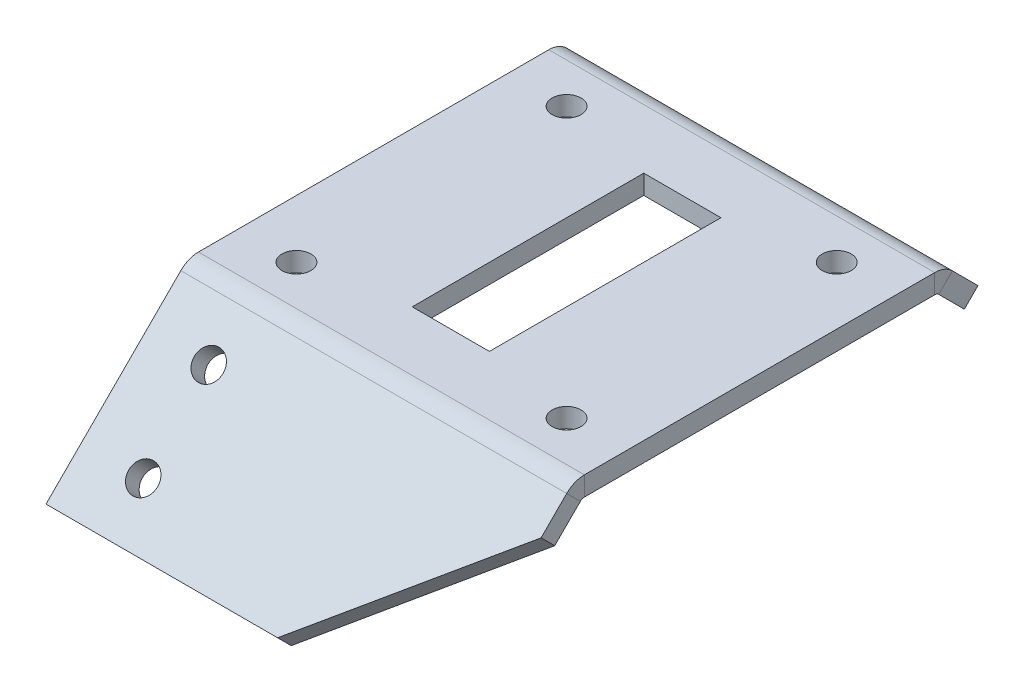
from build123d import *

# Parameters (mm, degrees)
SKETCH1_W                      = 50
SKETCH1_H                      = 46
BASE_FLANGE1_DEPTH             = 2.5
EDGE_FLANGE1_STRIP_CUT_DEPTH   = 50
EDGE_FLANGE1_STRIP_CUT_2_DEPTH = 50
EDGE_FLANGE1_DEPTH             = 50
EDGE_FLANGE1_BEND_DEPTH        = 50
CUT_EXTRUDE1_REACH             = 83.004
SKETCH13_R                     = 1.875
CUT_EXTRUDE2_REACH             = 70.62
SKETCH14_R                     = 1.875
CHAMFER1_SIZE                  = 20
CUT_EXTRUDE3_REACH             = 70.62
SKETCH15_W                     = 10
SKETCH15_H                     = 30


# Sheet-metal steps are written as plain solids
with BuildPart() as part:
    # Sketch1 → Base-Flange1 (new body)
    with BuildSketch(Plane(origin=(0, 0, 0), x_dir=(1, 0, 0), z_dir=(0, 1, 0))):
        with Locations((25, 0)):
            Rectangle(SKETCH1_W, SKETCH1_H)
    extrude(amount=BASE_FLANGE1_DEPTH)

    # Edge-Flange1 strip (across the edge) → Edge-Flange1 strip cut (cut)
    with BuildSketch(Plane(origin=(0, 0, -23), x_dir=(0, -0.7071067811865512, 0.7071067811865438), z_dir=(1, 0, 0))):
        Polygon((-9.66479933, 6.129265424), (-1.552021808, -1.983512098), (0.215745145, -0.215745145), (-7.897032377, 7.897032377), align=None)
    extrude(amount=EDGE_FLANGE1_STRIP_CUT_DEPTH, mode=Mode.SUBTRACT)

    # Edge-Flange1 strip 2 (across the edge) → Edge-Flange1 strip cut 2 (cut)
    with BuildSketch(Plane(origin=(50, 0, 23), x_dir=(0, -0.7071067811865512, -0.7071067811865438), z_dir=(-1, 0, 0))):
        Polygon((-9.66479933, 6.129265424), (-1.552021808, -1.983512098), (0.215745145, -0.215745145), (-7.897032377, 7.897032377), align=None)
    extrude(amount=EDGE_FLANGE1_STRIP_CUT_2_DEPTH, mode=Mode.SUBTRACT)

    # Edge-Flange1 section (across the edge) → Edge-Flange1 (add)
    with BuildSketch(Plane(origin=(0, 0, -23), x_dir=(0, -0.7071067811865512, 0.7071067811865438), z_dir=(1, 0, 0))):
        with BuildLine():
            Line((-2.5, 0.30510971), (-2.5, 25))
            Line((-2.5, 25), (0, 25))
            Line((0, 25), (0, 0.30510971))
            ThreePointArc((0, 0.30510971), (0.056070336, 0.023225094), (0.215745145, -0.215745145))
            Line((0.215745145, -0.215745145), (-1.552021808, -1.983512098))
            ThreePointArc((-1.552021808, -1.983512098), (-2.253628495, -0.933483487), (-2.5, 0.30510971))
        make_face()
    extrude(amount=EDGE_FLANGE1_DEPTH)

    # Edge-Flange1 section 2 (across the edge) → Edge-Flange1 bend (add)
    with BuildSketch(Plane(origin=(50, 0, 23), x_dir=(0, -0.7071067811865512, -0.7071067811865438), z_dir=(-1, 0, 0))):
        with BuildLine():
            Line((-2.5, 0.30510971), (-2.5, 25))
            Line((-2.5, 25), (0, 25))
            Line((0, 25), (0, 0.30510971))
            ThreePointArc((0, 0.30510971), (0.056070336, 0.023225094), (0.215745145, -0.215745145))
            Line((0.215745145, -0.215745145), (-1.552021808, -1.983512098))
            ThreePointArc((-1.552021808, -1.983512098), (-2.253628495, -0.933483487), (-2.5, 0.30510971))
        make_face()
    extrude(amount=EDGE_FLANGE1_BEND_DEPTH)

    # Sketch13 → Cut-Extrude1 (cut, up to next)
    with BuildSketch(Plane(origin=(0, 13.267766953, 13.267766953), x_dir=(1, 0, 0), z_dir=(0, 0.7071067811865513, 0.7071067811865438)), mode=Mode.PRIVATE) as cut_extrude1_sk1:
        with Locations(Location((8, -22.763455967, 0), (0, 0, 270))):
            Circle(SKETCH13_R)
    cut_extrude1_tool1 = extrude(cut_extrude1_sk1.sketch, amount=-CUT_EXTRUDE1_REACH, mode=Mode.PRIVATE) & part.part
    # Sketch13 → Cut-Extrude1 (cut, up to next)
    with BuildSketch(Plane(origin=(0, 13.267766953, 13.267766953), x_dir=(1, 0, 0), z_dir=(0, 0.7071067811865513, 0.7071067811865438)), mode=Mode.PRIVATE) as cut_extrude1_sk2:
        with Locations(Location((8, -34.763455967, 0), (0, 0, 270))):
            Circle(SKETCH13_R)
    cut_extrude1_tool2 = extrude(cut_extrude1_sk2.sketch, amount=-CUT_EXTRUDE1_REACH, mode=Mode.PRIVATE) & part.part
    cut_extrude1_1 = cut_extrude1_tool1.solids().sort_by_distance((8, -2.828427, 29.363961))[0]
    add(cut_extrude1_1, mode=Mode.SUBTRACT)
    cut_extrude1_2 = cut_extrude1_tool2.solids().sort_by_distance((8, -11.313708, 37.849242))[0]
    add(cut_extrude1_2, mode=Mode.SUBTRACT)
    cut_extrude1 = cut_extrude1_1 + cut_extrude1_2  # Cut-Extrude1 as one shape, for the pattern or mirror that repeats it

    # Mirror1: Cut-Extrude1 across plane
    add(cut_extrude1.mirror(Plane.XY), mode=Mode.SUBTRACT)

    # Sketch14 → Cut-Extrude2 (cut, up to next)
    with BuildSketch(Plane(origin=(0, 2.5, 0), x_dir=(1, 0, 0), z_dir=(0, 1, 0)), mode=Mode.PRIVATE) as cut_extrude2_sk1:
        with Locations(Location((7.5, 17.5, 0), (0, 0, 270))):
            Circle(SKETCH14_R)
    cut_extrude2_tool1 = extrude(cut_extrude2_sk1.sketch, amount=-CUT_EXTRUDE2_REACH, mode=Mode.PRIVATE) & part.part
    # Sketch14 → Cut-Extrude2 (cut, up to next)
    with BuildSketch(Plane(origin=(0, 2.5, 0), x_dir=(1, 0, 0), z_dir=(0, 1, 0)), mode=Mode.PRIVATE) as cut_extrude2_sk2:
        with Locations(Location((42.5, 17.5, 0), (0, 0, 270))):
            Circle(SKETCH14_R)
    cut_extrude2_tool2 = extrude(cut_extrude2_sk2.sketch, amount=-CUT_EXTRUDE2_REACH, mode=Mode.PRIVATE) & part.part
    # Sketch14 → Cut-Extrude2 (cut, up to next)
    with BuildSketch(Plane(origin=(0, 2.5, 0), x_dir=(1, 0, 0), z_dir=(0, 1, 0)), mode=Mode.PRIVATE) as cut_extrude2_sk3:
        with Locations(Location((7.5, -17.5, 0), (0, 0, 270))):
            Circle(SKETCH14_R)
    cut_extrude2_tool3 = extrude(cut_extrude2_sk3.sketch, amount=-CUT_EXTRUDE2_REACH, mode=Mode.PRIVATE) & part.part
    # Sketch14 → Cut-Extrude2 (cut, up to next)
    with BuildSketch(Plane(origin=(0, 2.5, 0), x_dir=(1, 0, 0), z_dir=(0, 1, 0)), mode=Mode.PRIVATE) as cut_extrude2_sk4:
        with Locations(Location((42.5, -17.5, 0), (0, 0, 270))):
            Circle(SKETCH14_R)
    cut_extrude2_tool4 = extrude(cut_extrude2_sk4.sketch, amount=-CUT_EXTRUDE2_REACH, mode=Mode.PRIVATE) & part.part
    add(cut_extrude2_tool1.solids().sort_by_distance((7.5, 2.5, -17.5))[0], mode=Mode.SUBTRACT)
    add(cut_extrude2_tool2.solids().sort_by_distance((42.5, 2.5, -17.5))[0], mode=Mode.SUBTRACT)
    add(cut_extrude2_tool3.solids().sort_by_distance((7.5, 2.5, 17.5))[0], mode=Mode.SUBTRACT)
    add(cut_extrude2_tool4.solids().sort_by_distance((42.5, 2.5, 17.5))[0], mode=Mode.SUBTRACT)

    # Chamfer1
    chamfer1_edges = [part.edges().sort_by_distance(p)[0] for p in [
        (50, -16.793786053, -41.561553006),
        (50, -16.793786053, 41.561553006),
    ]]
    chamfer(chamfer1_edges, length=CHAMFER1_SIZE)

    # Sketch15 → Cut-Extrude3 (cut, up to next)
    with BuildSketch(Plane(origin=(0, 2.5, 0), x_dir=(1, 0, 0), z_dir=(0, 1, 0)), mode=Mode.PRIVATE) as cut_extrude3_sk1:
        with Locations((25, 0)):
            Rectangle(SKETCH15_W, SKETCH15_H)
    cut_extrude3_tool1 = extrude(cut_extrude3_sk1.sketch, amount=-CUT_EXTRUDE3_REACH, mode=Mode.PRIVATE) & part.part
    add(cut_extrude3_tool1.solids().sort_by_distance((25, 2.5, 0))[0], mode=Mode.SUBTRACT)


solid = part.part
